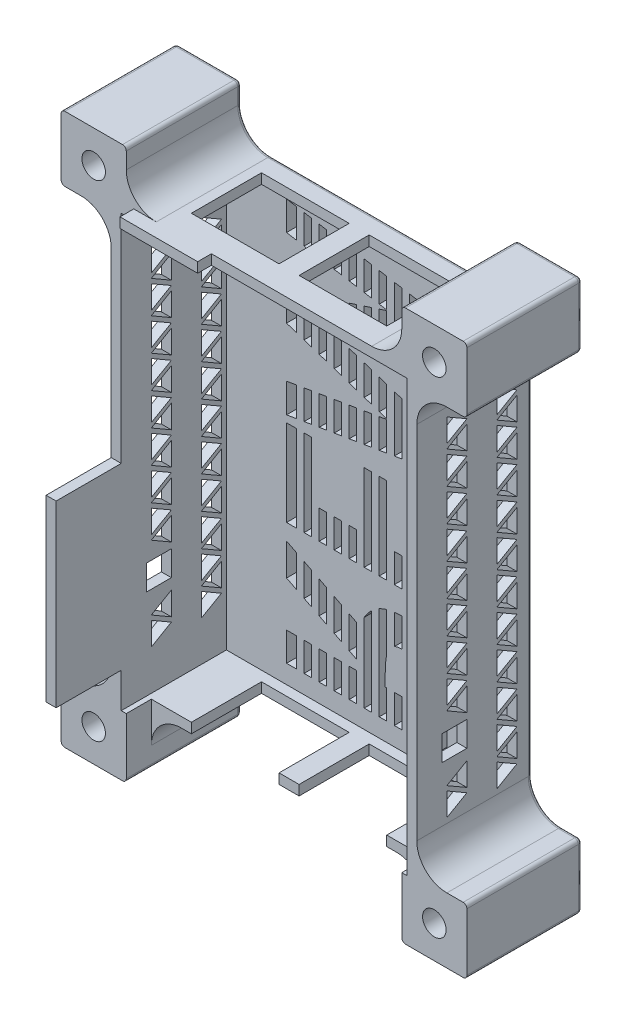
from build123d import *

# Parameters (mm, degrees)
SKETCH1_W            = 61
SKETCH1_H            = 90
BOSS_EXTRUDE1_DEPTH  = 4
SKETCH2_W            = 57
SKETCH2_H            = 86
CUT_EXTRUDE1_DEPTH   = 2
SKETCH3_W            = 61
SKETCH3_H            = 90
SKETCH3_W_2          = 57
SKETCH3_H_2          = 86
BOSS_EXTRUDE2_DEPTH  = 14
BOSS_EXTRUDE3_DEPTH  = 5
SKETCH5_W            = 17.5
SKETCH5_H            = 14
CUT_EXTRUDE2_DEPTH   = 5
SKETCH6_W            = 17.5
SKETCH6_H            = 14
CUT_EXTRUDE3_DEPTH   = 5
SKETCH7_W            = 2
SKETCH7_H            = 35.75
BOSS_EXTRUDE4_DEPTH  = 13
SKETCH8_W            = 5
SKETCH8_H            = 5
CUT_EXTRUDE4_DEPTH   = 115.529472189
CUT_EXTRUDE5_DEPTH   = 2
SKETCH16_W           = 15.5
SKETCH16_H           = 2
BOSS_EXTRUDE9_DEPTH  = 2.75
SKETCH22_W           = 1.5
SKETCH22_H           = 90
BOSS_EXTRUDE11_DEPTH = 2
FILLET5_R            = 0.75
BOSS_EXTRUDE13_START = -23
SKETCH36_W           = 13
SKETCH36_H           = 13
BOSS_EXTRUDE13_DEPTH = 23
SKETCH37_W           = 13
SKETCH37_H           = 13
BOSS_EXTRUDE14_DEPTH = 23
SKETCH41_W           = 1
SKETCH41_H           = 1
CUT_EXTRUDE13_DEPTH  = 21
SKETCH49_W           = 57.25
SKETCH49_H           = 0.75
BOSS_EXTRUDE15_DEPTH = 1
FILLET8_R            = 6
FILLET9_R            = 6
FILLET10_R           = 6
FILLET11_R           = 6
SKETCH46_R           = 2.35
CUT_EXTRUDE18_DEPTH  = 128.816274528
SKETCH50_W           = 5.5
SKETCH50_H           = 2.75
CUT_EXTRUDE19_DEPTH  = 128.816274528
BOSS_EXTRUDE16_DEPTH = 23
SKETCH52_R           = 2.35
CUT_EXTRUDE20_DEPTH  = 128.816274528
FILLET13_R           = 6
FILLET14_R           = 6
FILLET15_R           = 6
FILLET16_R           = 6
FILLET18_R           = 0.75


with BuildPart() as part:
    # Sketch1 → Boss-Extrude1 (new body)
    with BuildSketch(Plane.XY):
        with Locations((30.5, 45)):
            Rectangle(SKETCH1_W, SKETCH1_H)
    extrude(amount=BOSS_EXTRUDE1_DEPTH)

    # Sketch2 → Cut-Extrude1 (cut)
    with BuildSketch(Plane.XY.offset(4)):
        with Locations((30.5, 45)):
            Rectangle(SKETCH2_W, SKETCH2_H)
    extrude(amount=-CUT_EXTRUDE1_DEPTH, mode=Mode.SUBTRACT)

    # Sketch3 → Boss-Extrude2 (add)
    with BuildSketch(Plane.XY.offset(4)):
        with Locations((30.5, 45)):
            Rectangle(SKETCH3_W, SKETCH3_H)
        with Locations((30.5, 45)):
            Rectangle(SKETCH3_W_2, SKETCH3_H_2, mode=Mode.SUBTRACT)
    extrude(amount=BOSS_EXTRUDE2_DEPTH)

    # Sketch4 → Boss-Extrude3 (add)
    with BuildSketch(Plane.XY.offset(18)):
        Polygon((2, 2), (2, 88), (59, 88), (59, 2), (61, 2), (61, 90), (0, 90), (0, 2), align=None)
    extrude(amount=BOSS_EXTRUDE3_DEPTH)

    # Sketch5 → Cut-Extrude2 (cut)
    with BuildSketch(Plane(origin=(0, 0, 0), x_dir=(-1, 0, 0), z_dir=(0, -1, 0))):
        with Locations((-19.75, -11)):
            Rectangle(SKETCH5_W, SKETCH5_H)
        with Locations((-41.25, -11)):
            Rectangle(SKETCH5_W, SKETCH5_H)
    extrude(amount=-CUT_EXTRUDE2_DEPTH, mode=Mode.SUBTRACT)

    # Sketch6 → Cut-Extrude3 (cut)
    with BuildSketch(Plane(origin=(0, 90, 0), x_dir=(1, 0, 0), z_dir=(0, 1, 0))):
        with Locations((41.25, -11)):
            Rectangle(SKETCH6_W, SKETCH6_H)
        with Locations((19.75, -11)):
            Rectangle(SKETCH6_W, SKETCH6_H)
    extrude(amount=-CUT_EXTRUDE3_DEPTH, mode=Mode.SUBTRACT)

    # Sketch7 → Boss-Extrude4 (add)
    with BuildSketch(Plane.XY.offset(23)):
        with Locations((1, 26.875)):
            Rectangle(SKETCH7_W, SKETCH7_H)
    extrude(amount=BOSS_EXTRUDE4_DEPTH)

    # Sketch8 → Cut-Extrude4 (cut, through all)
    with BuildSketch(Plane(origin=(61, 0, 0), x_dir=(0, 0, -1), z_dir=(1, 0, 0))):
        Polygon((-13, 17.85196366), (-13, 13.233161507), (-17, 15.542562584), align=None)
        with Locations((-15.5, 22.5)):
            Rectangle(SKETCH8_W, SKETCH8_H)
        Polygon((-3, 12.309401077), (-7, 10), (-7, 14.618802154), align=None)
        Polygon((-3, 13.233161507), (-7, 15.542562584), (-3, 17.85196366), align=None)
        Polygon((-17, 14.618802154), (-13, 12.309401077), (-17, 10), align=None)
        Polygon((-13, 30.784609687), (-13, 26.165807534), (-17, 28.475208611), align=None)
        Polygon((-13, 37.250932701), (-13, 32.632130547), (-17, 34.941531624), align=None)
        Polygon((-17, 34.017771194), (-13, 31.708370117), (-17, 29.398969041), align=None)
        Polygon((-13, 43.717255714), (-13, 39.098453561), (-17, 41.407854638), align=None)
        Polygon((-17, 40.484094208), (-13, 38.174693131), (-17, 35.865292054), align=None)
        Polygon((-13, 50.183578728), (-13, 45.564776574), (-17, 47.874177651), align=None)
        Polygon((-17, 46.950417221), (-13, 44.641016144), (-17, 42.331615068), align=None)
        Polygon((-13, 56.649901741), (-13, 52.031099588), (-17, 54.340500665), align=None)
        Polygon((-17, 53.416740235), (-13, 51.107339158), (-17, 48.797938081), align=None)
        Polygon((-13, 63.116224755), (-13, 58.497422601), (-17, 60.806823678), align=None)
        Polygon((-17, 59.883063248), (-13, 57.573662171), (-17, 55.264261095), align=None)
        Polygon((-13, 69.582547768), (-13, 64.963745615), (-17, 67.273146692), align=None)
        Polygon((-17, 66.349386262), (-13, 64.039985185), (-17, 61.730584108), align=None)
        Polygon((-13, 76.048870782), (-13, 71.430068628), (-17, 73.739469705), align=None)
        Polygon((-17, 72.815709275), (-13, 70.506308198), (-17, 68.196907122), align=None)
        Polygon((-17, 79.282032289), (-13, 76.972631212), (-17, 74.663230135), align=None)
        Polygon((-3, 24.318286674), (-3, 19.69948452), (-7, 22.008885597), align=None)
        Polygon((-7, 21.085125167), (-3, 18.77572409), (-7, 16.466323014), align=None)
        Polygon((-3, 30.784609687), (-3, 26.165807534), (-7, 28.475208611), align=None)
        Polygon((-7, 27.551448181), (-3, 25.242047104), (-7, 22.932646027), align=None)
        Polygon((-3, 37.250932701), (-3, 32.632130547), (-7, 34.941531624), align=None)
        Polygon((-7, 34.017771194), (-3, 31.708370117), (-7, 29.398969041), align=None)
        Polygon((-3, 43.717255714), (-3, 39.098453561), (-7, 41.407854638), align=None)
        Polygon((-7, 40.484094208), (-3, 38.174693131), (-7, 35.865292054), align=None)
        Polygon((-3, 50.183578728), (-3, 45.564776574), (-7, 47.874177651), align=None)
        Polygon((-7, 46.950417221), (-3, 44.641016144), (-7, 42.331615068), align=None)
        Polygon((-3, 56.649901741), (-3, 52.031099588), (-7, 54.340500665), align=None)
        Polygon((-7, 53.416740235), (-3, 51.107339158), (-7, 48.797938081), align=None)
        Polygon((-3, 63.116224755), (-3, 58.497422601), (-7, 60.806823678), align=None)
        Polygon((-7, 59.883063248), (-3, 57.573662171), (-7, 55.264261095), align=None)
        Polygon((-3, 69.582547768), (-3, 64.963745615), (-7, 67.273146692), align=None)
        Polygon((-7, 66.349386262), (-3, 64.039985185), (-7, 61.730584108), align=None)
        Polygon((-3, 76.048870782), (-3, 71.430068628), (-7, 73.739469705), align=None)
        Polygon((-7, 72.815709275), (-3, 70.506308198), (-7, 68.196907122), align=None)
        Polygon((-7, 79.282032289), (-3, 76.972631212), (-7, 74.663230135), align=None)
    extrude(amount=-CUT_EXTRUDE4_DEPTH, mode=Mode.SUBTRACT)

    # Sketch9 → Cut-Extrude5 (cut)
    # profile 1 of 3: a face of its own
    with BuildSketch(Plane(origin=(-13.266512167, 62.494438007, 0), x_dir=(0, 1, 0), z_dir=(0, 0, -1))):
        with BuildLine():
            Line((-56.802130315, 59.266512167), (-50.109822622, 59.266512167))
            add(Edge.make_bspline(
                [(-50.109822622, 59.266512167), (-49.667463121, 59.264942045), (-48.816681194, 59.261922257), (-47.589900124, 59.214278008), (-46.462933001, 59.147977126), (-45.434111249, 59.046800219), (-44.503875014, 58.912651871), (-43.671291982, 58.754513167), (-42.93638649, 58.574280209), (-42.292960623, 58.349695725), (-41.712300595, 58.096367831), (-41.171044722, 57.805289436), (-40.657252094, 57.479701789), (-40.17435686, 57.111037799), (-39.718162547, 56.70592964), (-39.287808517, 56.26396953), (-38.889376072, 55.78140983), (-38.52533232, 55.261299705), (-38.193535744, 54.71415578), (-37.900297161, 54.139226823), (-37.661835058, 53.53611301), (-37.451128227, 52.913530638), (-37.299362923, 52.262579771), (-37.193812374, 51.589597526), (-37.116532391, 50.892214933), (-37.112089162, 50.418444162), (-37.109822622, 50.176768577)],
                knots=[0, 0, 0, 0, 1.749336639, 3.364467119, 4.854658419, 6.213483162, 7.451590619, 8.570285859, 9.5643256, 10.440900261, 11.26203566, 12.067320669, 12.869050712, 13.665104639, 14.467235401, 15.27997916, 16.102287765, 16.939272006, 17.78853747, 18.631303466, 19.488103222, 20.351255419, 21.228522269, 22.127379805, 23.044756219, 24, 24, 24, 24], degree=3))
            add(Edge.make_bspline(
                [(-37.109822622, 50.176768577), (-37.115710277, 49.924514784), (-37.127254893, 49.429891072), (-37.18944048, 48.70332918), (-37.303096198, 48.008205583), (-37.475244317, 47.346555516), (-37.673106221, 46.710143974), (-37.936211798, 46.110713148), (-38.233152446, 45.539545183), (-38.585820178, 45.004719469), (-38.972855785, 44.494356457), (-39.422970054, 44.028010047), (-39.907002495, 43.580615886), (-40.452162334, 43.180197226), (-41.034418419, 42.799679204), (-41.665339566, 42.45482854), (-42.340808166, 42.136976483), (-42.815696044, 41.95972022), (-43.058540571, 41.869076269)],
                knots=[0, 0, 0, 0, 1.099860209, 2.156625411, 3.176576793, 4.16617041, 5.135385252, 6.078461593, 7.016046972, 7.938469504, 8.868247731, 9.803980173, 10.76021508, 11.73834243, 12.748633912, 13.790971185, 14.870363756, 16, 16, 16, 16], degree=3))
            Line((-43.058540571, 41.869076269), (-35.673925186, 27.266512167))
            Line((-35.673925186, 27.266512167), (-42.058540571, 27.266512167))
            Line((-42.058540571, 27.266512167), (-49.109822622, 41.215230116))
            Line((-49.109822622, 41.215230116), (-51.058540571, 41.215230116))
            Line((-51.058540571, 41.215230116), (-51.058540571, 27.266512167))
            Line((-51.058540571, 27.266512167), (-56.802130315, 27.266512167))
            Line((-56.802130315, 27.266512167), (-56.802130315, 59.266512167))
        make_face()
        with BuildLine():
            Line((-51.058540571, 46.958819859), (-48.821361084, 46.958819859))
            add(Edge.make_bspline(
                [(-48.821361084, 46.958819859), (-48.547847295, 46.961900355), (-48.02412716, 46.967798843), (-47.27094882, 46.995158476), (-46.586883264, 47.061081673), (-45.968992883, 47.144373167), (-45.414168509, 47.240545226), (-44.927358981, 47.378365626), (-44.501063305, 47.526043673), (-44.140333102, 47.709569177), (-43.832133506, 47.918277481), (-43.56602288, 48.155375302), (-43.345911237, 48.429785839), (-43.164748128, 48.734051799), (-43.023822925, 49.070864337), (-42.920958323, 49.436526017), (-42.863472222, 49.835202194), (-42.856858251, 50.110343042), (-42.853412366, 50.253691654)],
                knots=[0, 0, 0, 0, 1.688639943, 3.233382647, 4.650958383, 5.928841754, 7.082724185, 8.122798841, 9.049171256, 9.863274652, 10.613301712, 11.341792392, 12.054588806, 12.776240173, 13.521029143, 14.301969904, 15.115324896, 16, 16, 16, 16], degree=3))
            add(Edge.make_bspline(
                [(-42.853412366, 50.253691654), (-42.859927127, 50.423283527), (-42.872724168, 50.756415335), (-42.999710567, 51.236008328), (-43.201845485, 51.679904456), (-43.478917095, 52.086098086), (-43.827852765, 52.442195463), (-44.228283977, 52.756098136), (-44.688853003, 53.004308883), (-45.115305262, 53.168026048), (-45.503277138, 53.265979718), (-45.853409516, 53.338973926), (-46.258864918, 53.390707016), (-46.719949441, 53.445579167), (-47.235487763, 53.481160979), (-47.808289878, 53.50712861), (-48.436710703, 53.517753243), (-48.874779702, 53.521149751), (-49.103412366, 53.522922423)],
                knots=[0, 0, 0, 0, 1.020303359, 2.004196876, 2.966617323, 3.9489082, 4.950758222, 5.960522915, 7.003732012, 8.091992268, 8.70421221, 9.413913587, 10.24622431, 11.166358409, 12.212345909, 13.359657661, 14.621978493, 16, 16, 16, 16], degree=3))
            Line((-49.103412366, 53.522922423), (-51.058540571, 53.522922423))
            Line((-51.058540571, 53.522922423), (-51.058540571, 46.958819859))
        make_face(mode=Mode.SUBTRACT)
    # profile 2 of 3: a face of its own
    with BuildSketch(Plane(origin=(-13.266512167, 62.494438007, 0), x_dir=(0, 1, 0), z_dir=(0, 0, -1))):
        Polygon((-32.453412366, 59.266512167), (-15.222643135, 59.266512167), (-15.222643135, 53.522922423), (-26.709822622, 53.522922423), (-26.709822622, 47.369076269), (-15.222643135, 47.369076269), (-15.222643135, 41.625486526), (-26.709822622, 41.625486526), (-26.709822622, 33.01010191), (-15.222643135, 33.01010191), (-15.222643135, 27.266512167), (-32.453412366, 27.266512167), align=None)
    # profile 3 of 3: a face of its own
    with BuildSketch(Plane(origin=(-13.266512167, 62.494438007, 0), x_dir=(0, 1, 0), z_dir=(0, 0, -1))):
        Polygon((-8.444438007, 59.266512167), (-2.495720058, 59.266512167), (4.818382506, 36.945999346), (12.170946608, 59.266512167), (18.074792762, 59.266512167), (23.485049173, 27.266512167), (17.670946608, 27.266512167), (14.254279942, 47.478050628), (7.600433788, 27.266512167), (2.004279942, 27.266512167), (-4.61751493, 47.478050628), (-8.02777134, 27.266512167), (-13.848284161, 27.266512167), align=None)
    extrude(amount=-CUT_EXTRUDE5_DEPTH, mode=Mode.SUBTRACT)


with BuildPart() as cut_extrude5_piece_1:
    # of the separate pieces the step leaves, piece 1, a body of its own (cut_extrude5_pieces)
    add(part.part.solids().sort_by_distance((0, 0, 18))[0])

    # Sketch16 → Boss-Extrude9 (add)
    with BuildSketch(Plane.XY.offset(23)):
        with Locations((12.25, 89)):
            Rectangle(SKETCH16_W, SKETCH16_H)
    extrude(amount=BOSS_EXTRUDE9_DEPTH)



with BuildPart() as cut_extrude5_piece_2:
    # of the separate pieces the step leaves, piece 2, a body of its own (cut_extrude5_pieces)
    add(part.part.solids().sort_by_distance((33.692307692, 11.435897436, 0))[0])


with BuildPart() as cut_extrude5_piece_1_1:
    add(cut_extrude5_piece_1.part)

    add(cut_extrude5_piece_2.part)  # Boss-Extrude11 merges Cut-Extrude5 piece 2
    # Sketch22 → Boss-Extrude11 (add)
    with BuildSketch(Plane(origin=(0, 0, 0), x_dir=(-1, 0, 0), z_dir=(0, 0, -1))):
        with Locations((-25.75, 45)):
            Rectangle(SKETCH22_W, SKETCH22_H)
        with Locations((-28.75, 45)):
            Rectangle(SKETCH22_W, SKETCH22_H)
        with Locations((-22.75, 45)):
            Rectangle(SKETCH22_W, SKETCH22_H)
        with Locations((-19.75, 45)):
            Rectangle(SKETCH22_W, SKETCH22_H)
        with Locations((-16.75, 45)):
            Rectangle(SKETCH22_W, SKETCH22_H)
        with Locations((-31.75, 45)):
            Rectangle(SKETCH22_W, SKETCH22_H)
        with Locations((-34.75, 45)):
            Rectangle(SKETCH22_W, SKETCH22_H)
        with Locations((-37.75, 45)):
            Rectangle(SKETCH22_W, SKETCH22_H)
        with Locations((-40.75, 45)):
            Rectangle(SKETCH22_W, SKETCH22_H)
        with Locations((-43.75, 45)):
            Rectangle(SKETCH22_W, SKETCH22_H)
        with Locations((-46.75, 45)):
            Rectangle(SKETCH22_W, SKETCH22_H)
        with Locations((-49.75, 45)):
            Rectangle(SKETCH22_W, SKETCH22_H)
    extrude(amount=-BOSS_EXTRUDE11_DEPTH)

    # Fillet5
    fillet5_edges = [cut_extrude5_piece_1_1.edges().sort_by_distance(p)[0] for p in [
        (30.5, 0, 0),
        (30.5, 90, 0),
        (0, 0, 9),
        (61, 90, 11.5),
        (61, 45, 0),
        (61, 0, 9),
        (0, 45, 0),
        (0, 90, 11.5),
    ]]
    fillet(fillet5_edges, radius=FILLET5_R)

    # Sketch36 → Boss-Extrude13 (add)
    with BuildSketch(Plane(origin=(0, 0, 0), x_dir=(-1, 0, 0), z_dir=(0, 0, -1)).offset(BOSS_EXTRUDE13_START)):
        with Locations((-64.5, -3.5)):
            Rectangle(SKETCH36_W, SKETCH36_H)
    extrude(amount=BOSS_EXTRUDE13_DEPTH)

    # Sketch37 → Boss-Extrude14 (add)
    with BuildSketch(Plane(origin=(0, 0, 0), x_dir=(-1, 0, 0), z_dir=(0, 0, -1))):
        with Locations((3.5, 93.5)):
            Rectangle(SKETCH37_W, SKETCH37_H)
    extrude(amount=-BOSS_EXTRUDE14_DEPTH)

    # Sketch41 → Cut-Extrude13 (cut)
    with BuildSketch(Plane.XY.offset(23)):
        with Locations((58.5, 2.5)):
            Rectangle(SKETCH41_W, SKETCH41_H)
        with Locations((2.5, 87.5)):
            Rectangle(SKETCH41_W, SKETCH41_H)
    extrude(amount=-CUT_EXTRUDE13_DEPTH, mode=Mode.SUBTRACT)

    # Sketch49 → Boss-Extrude15 (add)
    with BuildSketch(Plane(origin=(0, 0, 0), x_dir=(-1, 0, 0), z_dir=(0, 0, -1))):
        Polygon((-61, 90), (-61, 3), (-60.25, 3), (-60.25, 89.25), (-60.25, 90), align=None)
        with Locations((-31.625, 89.625)):
            Rectangle(SKETCH49_W, SKETCH49_H)
        Polygon((0, 87), (-0.75, 87), (-0.75, 0.75), (-0.75, 0), (0, 0), align=None)
        with Locations((-29.375, 0.375)):
            Rectangle(SKETCH49_W, SKETCH49_H)
    extrude(amount=-BOSS_EXTRUDE15_DEPTH)

    # Fillet8
    fillet8_edges = [cut_extrude5_piece_1_1.edges().sort_by_distance(p)[0] for p in [
        (61, 3, 11.5),
    ]]
    fillet(fillet8_edges, radius=FILLET8_R)

    # Fillet9
    fillet9_edges = [cut_extrude5_piece_1_1.edges().sort_by_distance(p)[0] for p in [
        (58, 0, 9),
    ]]
    fillet(fillet9_edges, radius=FILLET9_R)

    # Fillet10
    fillet10_edges = [cut_extrude5_piece_1_1.edges().sort_by_distance(p)[0] for p in [
        (3, 90, 11.5),
    ]]
    fillet(fillet10_edges, radius=FILLET10_R)

    # Fillet11
    fillet11_edges = [cut_extrude5_piece_1_1.edges().sort_by_distance(p)[0] for p in [
        (0, 87, 11.5),
    ]]
    fillet(fillet11_edges, radius=FILLET11_R)

    # Sketch46 → Cut-Extrude18 (cut, through all)
    with BuildSketch(Plane(origin=(0, 0, 0), x_dir=(-1, 0, 0), z_dir=(0, 0, -1))):
        with Locations((-64.5, -3.5)):
            Circle(SKETCH46_R)
        with Locations((3.5, 93.5)):
            Circle(SKETCH46_R)
    extrude(amount=-CUT_EXTRUDE18_DEPTH, mode=Mode.SUBTRACT)

    # Sketch50 → Cut-Extrude19 (cut, through all)
    with BuildSketch(Plane(origin=(0, 90, 0), x_dir=(1, 0, 0), z_dir=(0, 1, 0))):
        with Locations((7.25, -24.375)):
            Rectangle(SKETCH50_W, SKETCH50_H)
    extrude(amount=CUT_EXTRUDE19_DEPTH, mode=Mode.SUBTRACT)

    # Sketch51 → Boss-Extrude16 (add)
    with BuildSketch(Plane.XY.offset(23)):
        Polygon((-10, -10), (3, -10), (3, 2), (2, 2), (2, 3), (-10, 3), align=None)
        Polygon((59, 87), (71, 87), (71, 100), (58, 100), (58, 88), (59, 88), align=None)
    extrude(amount=-BOSS_EXTRUDE16_DEPTH)

    # Sketch52 → Cut-Extrude20 (cut, through all)
    with BuildSketch(Plane(origin=(0, 0, 0), x_dir=(-1, 0, 0), z_dir=(0, 0, -1))):
        with Locations((-64.5, 93.5)):
            Circle(SKETCH52_R)
        with Locations((3.5, -3.5)):
            Circle(SKETCH52_R)
    extrude(amount=-CUT_EXTRUDE20_DEPTH, mode=Mode.SUBTRACT)

    # Fillet13
    fillet13_edges = [cut_extrude5_piece_1_1.edges().sort_by_distance(p)[0] for p in [
        (58, 90, 11.5),
    ]]
    fillet(fillet13_edges, radius=FILLET13_R)

    # Fillet14
    fillet14_edges = [cut_extrude5_piece_1_1.edges().sort_by_distance(p)[0] for p in [
        (61, 87, 11.5),
    ]]
    fillet(fillet14_edges, radius=FILLET14_R)

    # Fillet15
    fillet15_edges = [cut_extrude5_piece_1_1.edges().sort_by_distance(p)[0] for p in [
        (3, 0, 9),
    ]]
    fillet(fillet15_edges, radius=FILLET15_R)

    # Fillet16
    fillet16_edges = [cut_extrude5_piece_1_1.edges().sort_by_distance(p)[0] for p in [
        (0, 3, 11.5),
    ]]
    fillet(fillet16_edges, radius=FILLET16_R)

    # Fillet18
    fillet18_edges = [cut_extrude5_piece_1_1.edges().sort_by_distance(p)[0] for p in [
        (71, 3, 11.5),
        (71, -3.5, 0),
        (64.5, -10, 0),
        (58, -8, 0),
        (71, -10, 11.5),
        (58, -10, 11.5),
        (-10, 87, 11.5),
        (-10, 93.5, 0),
        (-3.5, 100, 0),
        (3, 98, 0),
        (-10, 100, 11.5),
        (3, 100, 11.5),
        (61, 45, 0),
        (69, 3, 0),
        (62.757359313, 4.757359313, 0),
        (56.242640687, -1.757359313, 0),
        (4.757359313, 91.757359313, 0),
        (0, 45, 0),
        (-8, 87, 0),
        (-1.757359313, 85.242640687, 0),
        (-10, 3, 11.5),
        (-10, -3.5, 0),
        (-8, 3, 0),
        (-3.5, -10, 0),
        (3, -10, 11.5),
        (3, -8, 0),
        (-10, -10, 11.5),
        (71, 87, 11.5),
        (64.5, 100, 0),
        (71, 93.5, 0),
        (71, 100, 11.5),
        (58, 100, 11.5),
        (58, 98, 0),
        (30.5, 90, 0),
        (56.242640687, 91.757359313, 0),
        (69, 87, 0),
        (62.757359313, 85.242640687, 0),
        (30.5, 0, 0),
        (4.757359313, -1.757359313, 0),
        (-1.757359313, 4.757359313, 0),
    ]]
    fillet(fillet18_edges, radius=FILLET18_R)


solid = cut_extrude5_piece_1_1.part
